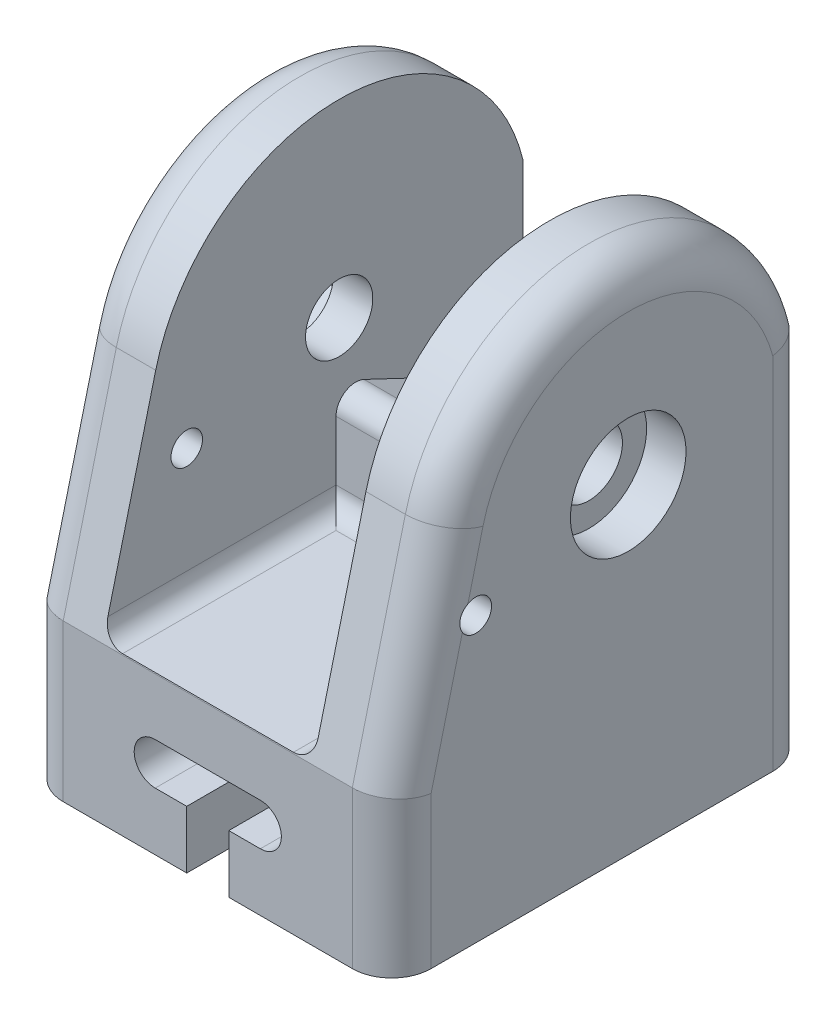
from build123d import *
from build123d.topology import SkipClean

# Parameters (mm, degrees)
BOSS_EXTRUDE1_DEPTH = 22.5
SKETCH3_W           = 10
SKETCH3_H           = 20
CUT_EXTRUDE1_DEPTH  = 17.5
SKETCH4_OUTSIDE_W   = 28.964
SKETCH4_OUTSIDE_H   = 31.464
SKETCH4_OUTSIDE_R   = 1.6
SKETCH4_OUTSIDE_R_2 = 0.75
CUT_EXTRUDE2_DEPTH  = 31.207614934
FILLET1_R           = 1.875
SKETCH7_W           = 20
SKETCH7_H           = 25
CUT_EXTRUDE4_DEPTH  = 8.75
BOSS_EXTRUDE3_DEPTH = 5
FILLET2_R           = 0.9375
SKETCH11_R          = 2.75
CUT_EXTRUDE6_DEPTH  = 1.875
CUT_EXTRUDE7_DEPTH  = 1.875
BOSS_EXTRUDE4_DEPTH = 0.2
BOSS_EXTRUDE9_START = 2.5
BOSS_EXTRUDE9_DEPTH = 2.5
CUT_EXTRUDE8_DEPTH  = 28.895609137


with BuildPart() as part:
    # Sketch2 → Boss-Extrude1 (new body)
    with BuildSketch(Plane(origin=(0, 0, 0), x_dir=(1, 0, 0), z_dir=(0, 1, 0))):
        Polygon((5, 10), (8.75, 10), (8.75, -10), (-8.75, -10), (-8.75, 10), (-5, 10), (-5, 5), (5, 5), align=None)
    extrude(amount=BOSS_EXTRUDE1_DEPTH)

    # Sketch3 → Cut-Extrude1 (cut)
    with BuildSketch(Plane(origin=(0, 22.5, 0), x_dir=(1, 0, 0), z_dir=(0, 1, 0))):
        Rectangle(SKETCH3_W, SKETCH3_H)
    extrude(amount=-CUT_EXTRUDE1_DEPTH, mode=Mode.SUBTRACT)

    # Sketch4 outside → Cut-Extrude2 (cut, through all)
    # profile 1 of 3: a face of its own
    with BuildSketch(Plane(origin=(8.75, 0, 0), x_dir=(0, 0, -1), z_dir=(1, 0, 0))):
        with Locations((0, 11.25)):
            Rectangle(SKETCH4_OUTSIDE_W, SKETCH4_OUTSIDE_H)
        with BuildLine():
            Line((10, 14.856537443), (10, 0))
            Line((10, 0), (-10, 0))
            Line((-10, 0), (-10, 4.952182367))
            Line((-10, 4.952182367), (-7.476419244, 14.952182367))
            ThreePointArc((-7.476419244, 14.952182367), (1.29925445, 21.749865221), (10, 14.856537443))
        make_face(mode=Mode.SUBTRACT)
    # profile 2 of 3: a face of its own
    with BuildSketch(Plane(origin=(8.75, 0, 0), x_dir=(0, 0, -1), z_dir=(1, 0, 0))):
        with Locations((1.25, 12.75)):
            Circle(SKETCH4_OUTSIDE_R)
    # profile 3 of 3: a face of its own
    with BuildSketch(Plane(origin=(8.75, 0, 0), x_dir=(0, 0, -1), z_dir=(1, 0, 0))):
        with Locations((-6, 11)):
            Circle(SKETCH4_OUTSIDE_R_2)
    extrude(amount=-CUT_EXTRUDE2_DEPTH, mode=Mode.SUBTRACT)

    # Fillet1
    # the kernel refuses this fillet: 1.875 mm, written as the material it takes off along each edge
    with BuildSketch(Plane(origin=(-8.75, -1.875, 10), x_dir=(1, 0, 0), z_dir=(0, 1, 0)), Plane(origin=(8.75, -1.875, 10), x_dir=(0, 0, -1), z_dir=(0, 1, 0))) as fillet1_piece_1:
        with BuildLine():
            CenterArc((FILLET1_R, FILLET1_R), FILLET1_R, 180, 90)
            Line((0, FILLET1_R), (-FILLET1_R * 0.02, FILLET1_R))
            Line((-FILLET1_R * 0.02, FILLET1_R), (-FILLET1_R * 0.02, -FILLET1_R * 0.02))
            Line((-FILLET1_R * 0.02, -FILLET1_R * 0.02), (FILLET1_R, -FILLET1_R * 0.02))
            Line((FILLET1_R, -FILLET1_R * 0.02), (FILLET1_R, 0))
        make_face()
    extrude(amount=8.702182367, mode=Mode.SUBTRACT)
    with BuildSketch(Plane(origin=(-8.75, -1.875, -10), x_dir=(0, 0, 1), z_dir=(0, 1, 0)), Plane(origin=(8.75, -1.875, -10), x_dir=(-1, 0, 0), z_dir=(0, 1, 0))) as fillet1_piece_2:
        with BuildLine():
            CenterArc((FILLET1_R, FILLET1_R), FILLET1_R, 180, 90)
            Line((0, FILLET1_R), (-FILLET1_R * 0.02, FILLET1_R))
            Line((-FILLET1_R * 0.02, FILLET1_R), (-FILLET1_R * 0.02, -FILLET1_R * 0.02))
            Line((-FILLET1_R * 0.02, -FILLET1_R * 0.02), (FILLET1_R, -FILLET1_R * 0.02))
            Line((FILLET1_R, -FILLET1_R * 0.02), (FILLET1_R, 0))
        make_face()
    extrude(amount=18.606537443, mode=Mode.SUBTRACT)
    with BuildSketch(Plane(origin=(8.75, 12.75, -1.25), x_dir=(0, 0.2446869297035112, 0.9696021382156028), z_dir=(0, -0.9696021382156028, 0.2446869297035112))) as fillet1_piece_3:
        with BuildLine():
            CenterArc((9 - FILLET1_R, FILLET1_R), FILLET1_R, 270, 90)
            Line((9, FILLET1_R), (9 + FILLET1_R * 0.02, FILLET1_R))
            Line((9 + FILLET1_R * 0.02, FILLET1_R), (9 + FILLET1_R * 0.02, -FILLET1_R * 0.02))
            Line((9 + FILLET1_R * 0.02, -FILLET1_R * 0.02), (9 - FILLET1_R, -FILLET1_R * 0.02))
            Line((9 - FILLET1_R, -FILLET1_R * 0.02), (9 - FILLET1_R, 0))
        make_face()
    revolve(axis=Axis((8.75, 12.75, -1.25), (-1, 0, 0)), revolution_arc=164.250823416, mode=Mode.SUBTRACT)
    with BuildSketch(Plane(origin=(-8.75, 12.75, -1.25), x_dir=(0, 0.027674657987308005, -0.9996169833017472), z_dir=(0, -0.9996169833017472, -0.027674657987308005))) as fillet1_piece_4:
        with BuildLine():
            CenterArc((9 - FILLET1_R, FILLET1_R), FILLET1_R, 270, 90)
            Line((9, FILLET1_R), (9 + FILLET1_R * 0.02, FILLET1_R))
            Line((9 + FILLET1_R * 0.02, FILLET1_R), (9 + FILLET1_R * 0.02, -FILLET1_R * 0.02))
            Line((9 + FILLET1_R * 0.02, -FILLET1_R * 0.02), (9 - FILLET1_R, -FILLET1_R * 0.02))
            Line((9 - FILLET1_R, -FILLET1_R * 0.02), (9 - FILLET1_R, 0))
        make_face()
    revolve(axis=Axis((-8.75, 12.75, -1.25), (1, 0, 0)), revolution_arc=164.250823416, mode=Mode.SUBTRACT)
    with BuildSketch(Plane(origin=(-8.75, 14.952182367, 7.476419244), x_dir=(0, -0.2446869297035113, -0.9696021382156028), z_dir=(0, -0.9696021382156028, 0.24468692970351133)), Plane(origin=(8.75, 3.134178358, 10.458787993), x_dir=(0, -0.24468692970351133, -0.9696021382156028), z_dir=(0, 0.9696021382156028, -0.24468692970351133))) as fillet1_piece_5:
        with BuildLine():
            CenterArc((FILLET1_R, FILLET1_R), FILLET1_R, 180, 90)
            Line((0, FILLET1_R), (-FILLET1_R * 0.02, FILLET1_R))
            Line((-FILLET1_R * 0.02, FILLET1_R), (-FILLET1_R * 0.02, -FILLET1_R * 0.02))
            Line((-FILLET1_R * 0.02, -FILLET1_R * 0.02), (FILLET1_R, -FILLET1_R * 0.02))
            Line((FILLET1_R, -FILLET1_R * 0.02), (FILLET1_R, 0))
        make_face()
    extrude(amount=12.188508609, mode=Mode.SUBTRACT)

    # Sketch7 → Cut-Extrude4 (cut)
    with BuildSketch(Plane(origin=(8.75, 0, 0), x_dir=(0, 0, -1), z_dir=(1, 0, 0))):
        with Locations((0, 12.5)):
            Rectangle(SKETCH7_W, SKETCH7_H)
    extrude(amount=-CUT_EXTRUDE4_DEPTH, mode=Mode.SUBTRACT)

    # Sketch8 → Boss-Extrude3 (add)
    with BuildSketch(Plane(origin=(-5, 0, 0), x_dir=(0, 0, -1), z_dir=(1, 0, 0))):
        Polygon((5, 5), (5, 8.4), (1.1, 10.25), (1.1, 5), align=None)
    extrude(amount=BOSS_EXTRUDE3_DEPTH)

    # Fillet2
    fillet2_edges = [part.edges().sort_by_distance(p)[0] for p in [
        (-5, 5, 4.443966417),
        (-2.5, 10.25, -1.1),
        (-2.5, 8.4, -5),
        (-2.5, 5, -1.1),
    ]]
    fillet(fillet2_edges, radius=FILLET2_R)

    # Mirror2: part across plane


with BuildPart() as part_1:
    add(part.part)
    add(part.part.mirror(Plane.ZY))

    # Sketch11 → Cut-Extrude6 (cut)
    with BuildSketch(Plane(origin=(8.75, 0, 0), x_dir=(0, 0, -1), z_dir=(1, 0, 0))):
        with Locations((1.25, 12.75)):
            Circle(SKETCH11_R)
    extrude(amount=-CUT_EXTRUDE6_DEPTH, mode=Mode.SUBTRACT)

    # Sketch12 → Cut-Extrude7 (cut)
    with BuildSketch(Plane.ZY.offset(8.75)):
        Polygon((-1.25, 15.925426481), (-4, 14.33771324), (-4, 11.16228676), (-1.25, 9.574573519), (1.5, 11.16228676), (1.5, 14.33771324), align=None)
    extrude(amount=-CUT_EXTRUDE7_DEPTH, mode=Mode.SUBTRACT)

    # Sketch13 → Boss-Extrude4 (add)
    with BuildSketch(Plane.ZY.offset(8.75)):
        with BuildLine():
            Line((-2.16945613, 9.400976563), (2.048930789, 9.400976563))
            Line((2.048930789, 9.400976563), (2.048930789, 8.9188752))
            Line((2.048930789, 8.9188752), (1.331428371, 8.9188752))
            add(Edge.make_bspline(
                [(1.331428371, 8.9188752), (1.259186082, 8.917703873), (1.128695628, 8.915588118), (0.953618084, 8.895075924), (0.820795157, 8.85890692), (0.722620482, 8.801340017), (0.66418865, 8.710271847), (0.629489236, 8.592812055), (0.605081268, 8.443393165), (0.603495672, 8.332064189), (0.602626703, 8.271051495)],
                knots=[0, 0, 0, 0, 1.473035235, 2.660727346, 3.584016889, 4.269332832, 4.922698946, 5.732321762, 6.757222385, 8, 8, 8, 8], degree=3))
            Line((0.602626703, 8.271051495), (0.602626703, 1.161939611))
            add(Edge.make_bspline(
                [(0.602626703, 1.161939611), (0.603806075, 1.097741152), (0.605941327, 0.981509859), (0.626332927, 0.828112382), (0.653959528, 0.708007797), (0.695819757, 0.652674401), (0.713736001, 0.628991621)],
                knots=[0, 0, 0, 0, 1.387279159, 2.511668523, 3.362991788, 4, 4, 4, 4], degree=3))
            add(Edge.make_bspline(
                [(0.713736001, 0.628991621), (0.742216021, 0.605874577), (0.803795028, 0.555891305), (0.927817777, 0.514891851), (1.077003332, 0.485769381), (1.186830669, 0.483395223), (1.246683991, 0.482101362)],
                knots=[0, 0, 0, 0, 0.773484526, 1.672414867, 2.731520698, 4, 4, 4, 4], degree=3))
            Line((1.246683991, 0.482101362), (2.048930789, 0.482101362))
            Line((2.048930789, 0.482101362), (2.048930789, 0))
            Line((2.048930789, 0), (-2.16945613, 0))
            Line((-2.16945613, 0), (-2.16945613, 0.482101362))
            Line((-2.16945613, 0.482101362), (-1.382274999, 0.482101362))
            add(Edge.make_bspline(
                [(-1.382274999, 0.482101362), (-1.31940414, 0.48301697), (-1.204997391, 0.484683112), (-1.050781582, 0.508492708), (-0.931283172, 0.545116887), (-0.839180191, 0.603218278), (-0.785035731, 0.698739607), (-0.746995159, 0.820804221), (-0.726559461, 0.979920139), (-0.7243631, 1.097246659), (-0.723152043, 1.161939611)],
                knots=[0, 0, 0, 0, 1.323224596, 2.407885381, 3.273374914, 3.948198526, 4.637756618, 5.528332226, 6.637141158, 8, 8, 8, 8], degree=3))
            Line((-0.723152043, 1.161939611), (-0.723152043, 8.271051495))
            add(Edge.make_bspline(
                [(-0.723152043, 8.271051495), (-0.724696232, 8.332673526), (-0.727462884, 8.443078849), (-0.743603421, 8.589300261), (-0.77489184, 8.700371502), (-0.815344506, 8.750765334), (-0.832378133, 8.771984942)],
                knots=[0, 0, 0, 0, 1.411879347, 2.529598496, 3.380849948, 4, 4, 4, 4], degree=3))
            add(Edge.make_bspline(
                [(-0.832378133, 8.771984942), (-0.866044035, 8.795002172), (-0.940377737, 8.845823799), (-1.084531483, 8.88950754), (-1.261441827, 8.914084364), (-1.390944762, 8.917187619), (-1.461369754, 8.9188752)],
                knots=[0, 0, 0, 0, 0.741247183, 1.636660366, 2.714792252, 4, 4, 4, 4], degree=3))
            Line((-1.461369754, 8.9188752), (-2.16945613, 8.9188752))
            Line((-2.16945613, 8.9188752), (-2.16945613, 9.400976563))
        make_face()
    extrude(amount=BOSS_EXTRUDE4_DEPTH)

    # Sketch19 → Boss-Extrude9 (add)
    with SkipClean():  # the faces are left unmerged after this step: merging them gives an invalid solid
        with BuildSketch(Plane.XZ.offset(BOSS_EXTRUDE9_START)):
            with BuildLine():
                Line((-8.75, 2.048930789), (-8.75, -2.16945613))
                Line((-8.75, -2.16945613), (-8.75, -8.125))
                ThreePointArc((-8.75, -8.125), (-8.200825215, -9.450825215), (-6.875, -10))
                Line((-6.875, -10), (-5, -10))
                Line((-5, -10), (-5, -5))
                Line((-5, -5), (5, -5))
                Line((5, -5), (5, -10))
                Line((5, -10), (6.875, -10))
                ThreePointArc((6.875, -10), (8.200825215, -9.450825215), (8.75, -8.125))
                Line((8.75, -8.125), (8.75, 8.125))
                ThreePointArc((8.75, 8.125), (8.200825215, 9.450825215), (6.875, 10))
                Line((6.875, 10), (-6.875, 10))
                ThreePointArc((-6.875, 10), (-8.200825215, 9.450825215), (-8.75, 8.125))
                Line((-8.75, 8.125), (-8.75, 2.048930789))
            make_face()
        extrude(amount=-BOSS_EXTRUDE9_DEPTH)

    # Sketch20 → Cut-Extrude8 (cut, through all)
    with SkipClean():  # the faces are left unmerged after this step: merging them gives an invalid solid
        with BuildSketch(Plane(origin=(0, 0, -5), x_dir=(-1, 0, 0), z_dir=(0, 0, -1))):
            with BuildLine():
                Line((1, 0.25), (2.5, 0.25))
                ThreePointArc((2.5, 0.25), (3.5, 1.25), (2.5, 2.25))
                Line((2.5, 2.25), (-2.5, 2.25))
                ThreePointArc((-2.5, 2.25), (-3.5, 1.25), (-2.5, 0.25))
                Line((-2.5, 0.25), (-1, 0.25))
                Line((-1, 0.25), (-1, -2.5))
                ThreePointArc((-1, -2.5), (0, -3.5), (1, -2.5))
                Line((1, -2.5), (1, 0.25))
            make_face()
        extrude(amount=-CUT_EXTRUDE8_DEPTH, mode=Mode.SUBTRACT)


solid = part_1.part
